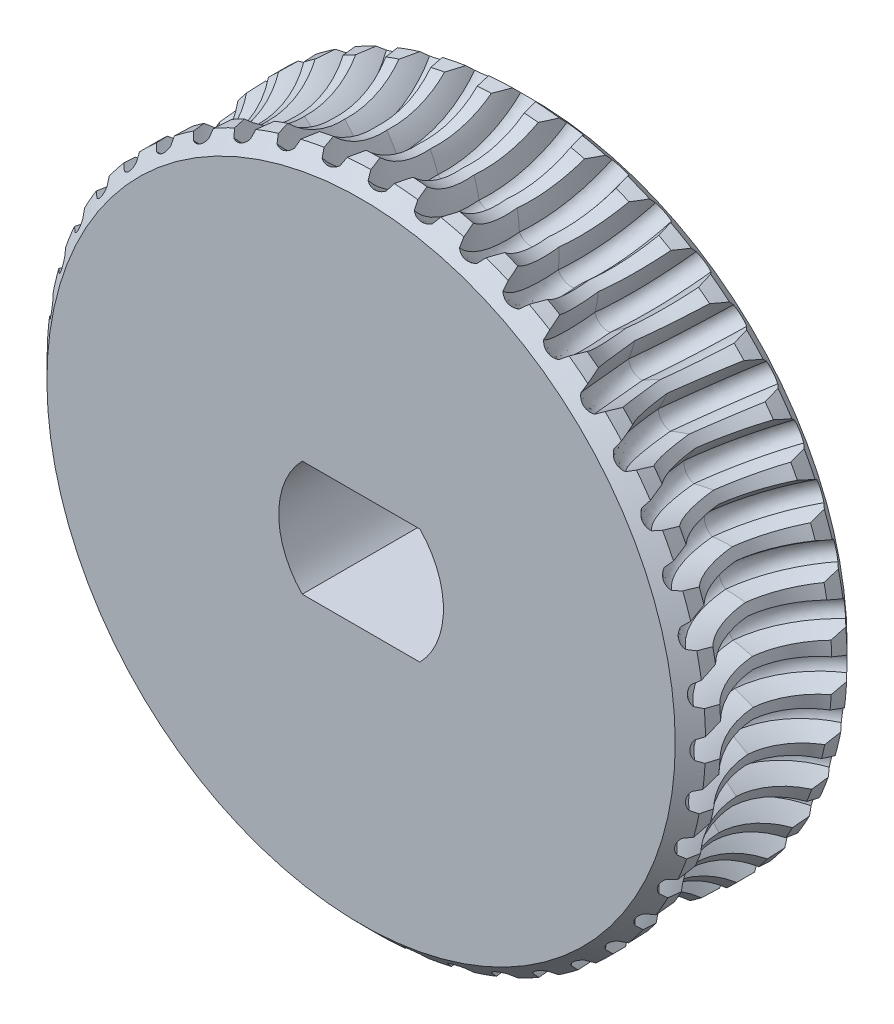
from build123d import *

# Parameters (mm, degrees)
SKETCH1_R                       = 43.5
BOSS_EXTRUDE1_DEPTH             = 11.35
CHAMFER1_SIZE                   = 2
SKETCH2_R                       = 10.5
CUT_SWEEP1_PITCH                = 6
CUT_SWEEP1_HEIGHT               = 1.5
CUT_SWEEP1_RADIUS               = 10.5
CUT_SWEEP1_START_ANGLE          = -90
CIRPATTERN1_COUNT               = 44
CIRPATTERN1_COPY_1_PITCH        = 6
CIRPATTERN1_COPY_1_HEIGHT       = 1.5
CIRPATTERN1_COPY_1_RADIUS       = 10.5
CIRPATTERN1_COPY_1_START_ANGLE  = -180
CIRPATTERN1_COPY_2_PITCH        = 6
CIRPATTERN1_COPY_2_HEIGHT       = 1.5
CIRPATTERN1_COPY_2_RADIUS       = 10.5
CIRPATTERN1_COPY_2_START_ANGLE  = -180
CIRPATTERN1_COPY_3_PITCH        = 6
CIRPATTERN1_COPY_3_HEIGHT       = 1.5
CIRPATTERN1_COPY_3_RADIUS       = 10.5
CIRPATTERN1_COPY_3_START_ANGLE  = -180
CIRPATTERN1_COPY_4_PITCH        = 6
CIRPATTERN1_COPY_4_HEIGHT       = 1.5
CIRPATTERN1_COPY_4_RADIUS       = 10.5
CIRPATTERN1_COPY_4_START_ANGLE  = -180
CIRPATTERN1_COPY_5_PITCH        = 6
CIRPATTERN1_COPY_5_HEIGHT       = 1.5
CIRPATTERN1_COPY_5_RADIUS       = 10.5
CIRPATTERN1_COPY_5_START_ANGLE  = -180
CIRPATTERN1_COPY_6_PITCH        = 6
CIRPATTERN1_COPY_6_HEIGHT       = 1.5
CIRPATTERN1_COPY_6_RADIUS       = 10.5
CIRPATTERN1_COPY_7_PITCH        = 6
CIRPATTERN1_COPY_7_HEIGHT       = 1.5
CIRPATTERN1_COPY_7_RADIUS       = 10.5
CIRPATTERN1_COPY_8_PITCH        = 6
CIRPATTERN1_COPY_8_HEIGHT       = 1.5
CIRPATTERN1_COPY_8_RADIUS       = 10.5
CIRPATTERN1_COPY_9_PITCH        = 6
CIRPATTERN1_COPY_9_HEIGHT       = 1.5
CIRPATTERN1_COPY_9_RADIUS       = 10.5
CIRPATTERN1_COPY_10_PITCH       = 6
CIRPATTERN1_COPY_10_HEIGHT      = 1.5
CIRPATTERN1_COPY_10_RADIUS      = 10.5
CIRPATTERN1_COPY_11_PITCH       = 6
CIRPATTERN1_COPY_11_HEIGHT      = 1.5
CIRPATTERN1_COPY_11_RADIUS      = 10.5
CIRPATTERN1_COPY_11_START_ANGLE = 90
CIRPATTERN1_COPY_12_PITCH       = 6
CIRPATTERN1_COPY_12_HEIGHT      = 1.5
CIRPATTERN1_COPY_12_RADIUS      = 10.5
CIRPATTERN1_COPY_13_PITCH       = 6
CIRPATTERN1_COPY_13_HEIGHT      = 1.5
CIRPATTERN1_COPY_13_RADIUS      = 10.5
CIRPATTERN1_COPY_14_PITCH       = 6
CIRPATTERN1_COPY_14_HEIGHT      = 1.5
CIRPATTERN1_COPY_14_RADIUS      = 10.5
CIRPATTERN1_COPY_15_PITCH       = 6
CIRPATTERN1_COPY_15_HEIGHT      = 1.5
CIRPATTERN1_COPY_15_RADIUS      = 10.5
CIRPATTERN1_COPY_16_PITCH       = 6
CIRPATTERN1_COPY_16_HEIGHT      = 1.5
CIRPATTERN1_COPY_16_RADIUS      = 10.5
CIRPATTERN1_COPY_17_PITCH       = 6
CIRPATTERN1_COPY_17_HEIGHT      = 1.5
CIRPATTERN1_COPY_17_RADIUS      = 10.5
CIRPATTERN1_COPY_17_START_ANGLE = -180
CIRPATTERN1_COPY_18_PITCH       = 6
CIRPATTERN1_COPY_18_HEIGHT      = 1.5
CIRPATTERN1_COPY_18_RADIUS      = 10.5
CIRPATTERN1_COPY_18_START_ANGLE = -180
CIRPATTERN1_COPY_19_PITCH       = 6
CIRPATTERN1_COPY_19_HEIGHT      = 1.5
CIRPATTERN1_COPY_19_RADIUS      = 10.5
CIRPATTERN1_COPY_19_START_ANGLE = -180
CIRPATTERN1_COPY_20_PITCH       = 6
CIRPATTERN1_COPY_20_HEIGHT      = 1.5
CIRPATTERN1_COPY_20_RADIUS      = 10.5
CIRPATTERN1_COPY_20_START_ANGLE = -180
CIRPATTERN1_COPY_21_PITCH       = 6
CIRPATTERN1_COPY_21_HEIGHT      = 1.5
CIRPATTERN1_COPY_21_RADIUS      = 10.5
CIRPATTERN1_COPY_21_START_ANGLE = -180
CIRPATTERN1_COPY_22_PITCH       = 6
CIRPATTERN1_COPY_22_HEIGHT      = 1.5
CIRPATTERN1_COPY_22_RADIUS      = 10.5
CIRPATTERN1_COPY_22_START_ANGLE = 90
CIRPATTERN1_COPY_23_PITCH       = 6
CIRPATTERN1_COPY_23_HEIGHT      = 1.5
CIRPATTERN1_COPY_23_RADIUS      = 10.5
CIRPATTERN1_COPY_23_START_ANGLE = -180
CIRPATTERN1_COPY_24_PITCH       = 6
CIRPATTERN1_COPY_24_HEIGHT      = 1.5
CIRPATTERN1_COPY_24_RADIUS      = 10.5
CIRPATTERN1_COPY_24_START_ANGLE = -180
CIRPATTERN1_COPY_25_PITCH       = 6
CIRPATTERN1_COPY_25_HEIGHT      = 1.5
CIRPATTERN1_COPY_25_RADIUS      = 10.5
CIRPATTERN1_COPY_25_START_ANGLE = -180
CIRPATTERN1_COPY_26_PITCH       = 6
CIRPATTERN1_COPY_26_HEIGHT      = 1.5
CIRPATTERN1_COPY_26_RADIUS      = 10.5
CIRPATTERN1_COPY_26_START_ANGLE = -180
CIRPATTERN1_COPY_27_PITCH       = 6
CIRPATTERN1_COPY_27_HEIGHT      = 1.5
CIRPATTERN1_COPY_27_RADIUS      = 10.5
CIRPATTERN1_COPY_27_START_ANGLE = -180
CIRPATTERN1_COPY_28_PITCH       = 6
CIRPATTERN1_COPY_28_HEIGHT      = 1.5
CIRPATTERN1_COPY_28_RADIUS      = 10.5
CIRPATTERN1_COPY_29_PITCH       = 6
CIRPATTERN1_COPY_29_HEIGHT      = 1.5
CIRPATTERN1_COPY_29_RADIUS      = 10.5
CIRPATTERN1_COPY_30_PITCH       = 6
CIRPATTERN1_COPY_30_HEIGHT      = 1.5
CIRPATTERN1_COPY_30_RADIUS      = 10.5
CIRPATTERN1_COPY_31_PITCH       = 6
CIRPATTERN1_COPY_31_HEIGHT      = 1.5
CIRPATTERN1_COPY_31_RADIUS      = 10.5
CIRPATTERN1_COPY_32_PITCH       = 6
CIRPATTERN1_COPY_32_HEIGHT      = 1.5
CIRPATTERN1_COPY_32_RADIUS      = 10.5
CIRPATTERN1_COPY_33_PITCH       = 6
CIRPATTERN1_COPY_33_HEIGHT      = 1.5
CIRPATTERN1_COPY_33_RADIUS      = 10.5
CIRPATTERN1_COPY_33_START_ANGLE = -90
CIRPATTERN1_COPY_34_PITCH       = 6
CIRPATTERN1_COPY_34_HEIGHT      = 1.5
CIRPATTERN1_COPY_34_RADIUS      = 10.5
CIRPATTERN1_COPY_35_PITCH       = 6
CIRPATTERN1_COPY_35_HEIGHT      = 1.5
CIRPATTERN1_COPY_35_RADIUS      = 10.5
CIRPATTERN1_COPY_36_PITCH       = 6
CIRPATTERN1_COPY_36_HEIGHT      = 1.5
CIRPATTERN1_COPY_36_RADIUS      = 10.5
CIRPATTERN1_COPY_37_PITCH       = 6
CIRPATTERN1_COPY_37_HEIGHT      = 1.5
CIRPATTERN1_COPY_37_RADIUS      = 10.5
CIRPATTERN1_COPY_38_PITCH       = 6
CIRPATTERN1_COPY_38_HEIGHT      = 1.5
CIRPATTERN1_COPY_38_RADIUS      = 10.5
CIRPATTERN1_COPY_39_PITCH       = 6
CIRPATTERN1_COPY_39_HEIGHT      = 1.5
CIRPATTERN1_COPY_39_RADIUS      = 10.5
CIRPATTERN1_COPY_39_START_ANGLE = -180
CIRPATTERN1_COPY_40_PITCH       = 6
CIRPATTERN1_COPY_40_HEIGHT      = 1.5
CIRPATTERN1_COPY_40_RADIUS      = 10.5
CIRPATTERN1_COPY_40_START_ANGLE = -180
CIRPATTERN1_COPY_41_PITCH       = 6
CIRPATTERN1_COPY_41_HEIGHT      = 1.5
CIRPATTERN1_COPY_41_RADIUS      = 10.5
CIRPATTERN1_COPY_41_START_ANGLE = -180
CIRPATTERN1_COPY_42_PITCH       = 6
CIRPATTERN1_COPY_42_HEIGHT      = 1.5
CIRPATTERN1_COPY_42_RADIUS      = 10.5
CIRPATTERN1_COPY_42_START_ANGLE = -180
CIRPATTERN1_COPY_43_PITCH       = 6
CIRPATTERN1_COPY_43_HEIGHT      = 1.5
CIRPATTERN1_COPY_43_RADIUS      = 10.5
CIRPATTERN1_COPY_43_START_ANGLE = -180
ESCALA2_SCALE                   = 0.2298
CORTE_EXTRUS_O1_DEPTH           = 35


with BuildPart() as part:
    # Sketch1 → Boss-Extrude1 (new, symmetric)
    with BuildSketch(Plane.XY):
        Circle(SKETCH1_R)
    extrude(amount=BOSS_EXTRUDE1_DEPTH, both=True)

    # Chamfer1
    chamfer1_edges = [part.edges().sort_by_distance(p)[0] for p in [
        (-43.5, 0, -11.35),
        (-43.5, 0, 11.35),
    ]]
    chamfer(chamfer1_edges, length=CHAMFER1_SIZE)

    # Sketch2 → Cut-Revolve2 (revolve, cut)
    with BuildSketch(Plane(origin=(0, 0, 0), x_dir=(0, 0, -1), z_dir=(1, 0, 0)), mode=Mode.PRIVATE) as cut_revolve2_sk:
        with Locations((0, -51)):
            Circle(SKETCH2_R)
    cut_revolve2 = revolve(cut_revolve2_sk.sketch.rotate(Axis((0, 0, 0), (0, 0, -1)), 270), axis=Axis((0, 0, 0), (0, 0, -1)), mode=Mode.SUBTRACT)

    # Cut-Sweep1: sweep along a helix
    with BuildLine() as cut_sweep1_path:
        add(Helix(CUT_SWEEP1_PITCH, CUT_SWEEP1_HEIGHT, CUT_SWEEP1_RADIUS, center=(0, -51, 0), direction=(-1, 0, 0), lefthand=True, mode=Mode.PRIVATE).rotate(Axis((0, -51, 0), (-1, 0, 0)), CUT_SWEEP1_START_ANGLE))
    # Sketch4 → Cut-Sweep1 (sweep, cut)
    with BuildSketch(Plane.XY):
        with BuildLine():
            Line((-3.36, -44.65), (3.54, -44.65))
            Line((3.54, -44.65), (3.54, -42.65))
            ThreePointArc((3.54, -42.65), (2.196170057, -40.410449873), (1.19058809, -38))
            ThreePointArc((1.19058809, -38), (0, -37.55), (-1.19058809, -38))
            ThreePointArc((-1.19058809, -38), (-2.108749999, -40.402699492), (-3.36, -42.65))
            Line((-3.36, -42.65), (-3.36, -44.65))
        make_face()
    cut_sweep1 = sweep(path=cut_sweep1_path.line, is_frenet=True, mode=Mode.SUBTRACT)

    # Mirror1: Cut-Sweep1 across plane
    add(cut_sweep1.mirror(Plane.XY), mode=Mode.SUBTRACT)

    # CirPattern1: Cut-Revolve2, Cut-Sweep1 ×44 about axis
    cirpattern1_axis = Axis((0, 0, 7.348469228), (0, 0, -1))
    add([cut_revolve2.rotate(cirpattern1_axis, i * 360 / CIRPATTERN1_COUNT) for i in range(1, CIRPATTERN1_COUNT)], mode=Mode.SUBTRACT)
    add([cut_sweep1.rotate(cirpattern1_axis, i * 360 / CIRPATTERN1_COUNT) for i in range(1, CIRPATTERN1_COUNT)], mode=Mode.SUBTRACT)

    # CirPattern1 copy 1: sweep along a helix
    with BuildLine() as cirpattern1_copy_1_path:
        add(Helix(CIRPATTERN1_COPY_1_PITCH, CIRPATTERN1_COPY_1_HEIGHT, CIRPATTERN1_COPY_1_RADIUS, center=(-7.258056752, -50.480893536, 0), direction=(-0.9898214418809327, 0.14231483827328514, 0), mode=Mode.PRIVATE).rotate(Axis((-7.258056752, -50.480893536, 0), (-0.9898214418809327, 0.14231483827328514, 0)), CIRPATTERN1_COPY_1_START_ANGLE))
    # CirPattern1 copy 1 sketch → CirPattern1 copy 1 (sweep, cut)
    with BuildSketch(Plane(origin=(0, 0, 0), x_dir=(0.9898214418809327, -0.14231483827328514, 0), z_dir=(0, 0, -1))):
        with BuildLine():
            Line((-3.36, 44.65), (3.54, 44.65))
            Line((3.54, 44.65), (3.54, 42.65))
            ThreePointArc((3.54, 42.65), (2.196170057, 40.410449873), (1.19058809, 38))
            ThreePointArc((1.19058809, 38), (0, 37.55), (-1.19058809, 38))
            ThreePointArc((-1.19058809, 38), (-2.108749999, 40.402699492), (-3.36, 42.65))
            Line((-3.36, 42.65), (-3.36, 44.65))
        make_face()
    sweep(path=cirpattern1_copy_1_path.line, is_frenet=True, mode=Mode.SUBTRACT)

    # CirPattern1 copy 2: sweep along a helix
    with BuildLine() as cirpattern1_copy_2_path:
        add(Helix(CIRPATTERN1_COPY_2_PITCH, CIRPATTERN1_COPY_2_HEIGHT, CIRPATTERN1_COPY_2_RADIUS, center=(-14.368360399, -48.934141654, 0), direction=(-0.9594929736144974, 0.28173255684142967, 0), mode=Mode.PRIVATE).rotate(Axis((-14.368360399, -48.934141654, 0), (-0.9594929736144974, 0.28173255684142967, 0)), CIRPATTERN1_COPY_2_START_ANGLE))
    # CirPattern1 copy 2 sketch → CirPattern1 copy 2 (sweep, cut)
    with BuildSketch(Plane(origin=(0, 0, 0), x_dir=(0.9594929736144974, -0.28173255684142967, 0), z_dir=(0, 0, -1))):
        with BuildLine():
            Line((-3.36, 44.65), (3.54, 44.65))
            Line((3.54, 44.65), (3.54, 42.65))
            ThreePointArc((3.54, 42.65), (2.196170057, 40.410449873), (1.19058809, 38))
            ThreePointArc((1.19058809, 38), (0, 37.55), (-1.19058809, 38))
            ThreePointArc((-1.19058809, 38), (-2.108749999, 40.402699492), (-3.36, 42.65))
            Line((-3.36, 42.65), (-3.36, 44.65))
        make_face()
    sweep(path=cirpattern1_copy_2_path.line, is_frenet=True, mode=Mode.SUBTRACT)

    # CirPattern1 copy 3: sweep along a helix
    with BuildLine() as cirpattern1_copy_3_path:
        add(Helix(CIRPATTERN1_COPY_3_PITCH, CIRPATTERN1_COPY_3_HEIGHT, CIRPATTERN1_COPY_3_RADIUS, center=(-21.186165663, -46.391231763, 0), direction=(-0.9096319953545183, 0.41541501300188644, 0), mode=Mode.PRIVATE).rotate(Axis((-21.186165663, -46.391231763, 0), (-0.9096319953545183, 0.41541501300188644, 0)), CIRPATTERN1_COPY_3_START_ANGLE))
    # CirPattern1 copy 3 sketch → CirPattern1 copy 3 (sweep, cut)
    with BuildSketch(Plane(origin=(0, 0, 0), x_dir=(0.9096319953545183, -0.41541501300188644, 0), z_dir=(0, 0, -1))):
        with BuildLine():
            Line((-3.36, 44.65), (3.54, 44.65))
            Line((3.54, 44.65), (3.54, 42.65))
            ThreePointArc((3.54, 42.65), (2.196170057, 40.410449873), (1.19058809, 38))
            ThreePointArc((1.19058809, 38), (0, 37.55), (-1.19058809, 38))
            ThreePointArc((-1.19058809, 38), (-2.108749999, 40.402699492), (-3.36, 42.65))
            Line((-3.36, 42.65), (-3.36, 44.65))
        make_face()
    sweep(path=cirpattern1_copy_3_path.line, is_frenet=True, mode=Mode.SUBTRACT)

    # CirPattern1 copy 4: sweep along a helix
    with BuildLine() as cirpattern1_copy_4_path:
        add(Helix(CIRPATTERN1_COPY_4_PITCH, CIRPATTERN1_COPY_4_HEIGHT, CIRPATTERN1_COPY_4_RADIUS, center=(-27.57268169, -42.903930174, 0), direction=(-0.8412535328311812, 0.5406408174555976, 0), mode=Mode.PRIVATE).rotate(Axis((-27.57268169, -42.903930174, 0), (-0.8412535328311812, 0.5406408174555976, 0)), CIRPATTERN1_COPY_4_START_ANGLE))
    # CirPattern1 copy 4 sketch → CirPattern1 copy 4 (sweep, cut)
    with BuildSketch(Plane(origin=(0, 0, 0), x_dir=(0.8412535328311812, -0.5406408174555976, 0), z_dir=(0, 0, -1))):
        with BuildLine():
            Line((-3.36, 44.65), (3.54, 44.65))
            Line((3.54, 44.65), (3.54, 42.65))
            ThreePointArc((3.54, 42.65), (2.196170057, 40.410449873), (1.19058809, 38))
            ThreePointArc((1.19058809, 38), (0, 37.55), (-1.19058809, 38))
            ThreePointArc((-1.19058809, 38), (-2.108749999, 40.402699492), (-3.36, 42.65))
            Line((-3.36, 42.65), (-3.36, 44.65))
        make_face()
    sweep(path=cirpattern1_copy_4_path.line, is_frenet=True, mode=Mode.SUBTRACT)

    # CirPattern1 copy 5: sweep along a helix
    with BuildLine() as cirpattern1_copy_5_path:
        add(Helix(CIRPATTERN1_COPY_5_PITCH, CIRPATTERN1_COPY_5_HEIGHT, CIRPATTERN1_COPY_5_RADIUS, center=(-33.397897431, -38.543228292, 0), direction=(-0.7557495743542584, 0.654860733945285, 0), mode=Mode.PRIVATE).rotate(Axis((-33.397897431, -38.543228292, 0), (-0.7557495743542584, 0.654860733945285, 0)), CIRPATTERN1_COPY_5_START_ANGLE))
    # CirPattern1 copy 5 sketch → CirPattern1 copy 5 (sweep, cut)
    with BuildSketch(Plane(origin=(0, 0, 0), x_dir=(0.7557495743542584, -0.654860733945285, 0), z_dir=(0, 0, -1))):
        with BuildLine():
            Line((-3.36, 44.65), (3.54, 44.65))
            Line((3.54, 44.65), (3.54, 42.65))
            ThreePointArc((3.54, 42.65), (2.196170057, 40.410449873), (1.19058809, 38))
            ThreePointArc((1.19058809, 38), (0, 37.55), (-1.19058809, 38))
            ThreePointArc((-1.19058809, 38), (-2.108749999, 40.402699492), (-3.36, 42.65))
            Line((-3.36, 42.65), (-3.36, 44.65))
        make_face()
    sweep(path=cirpattern1_copy_5_path.line, is_frenet=True, mode=Mode.SUBTRACT)

    # CirPattern1 copy 6: sweep along a helix
    with BuildLine() as cirpattern1_copy_6_path:
        Helix(CIRPATTERN1_COPY_6_PITCH, CIRPATTERN1_COPY_6_HEIGHT, CIRPATTERN1_COPY_6_RADIUS, center=(-38.543228292, -33.397897431, 0), direction=(-0.654860733945285, 0.7557495743542583, 0))
    # CirPattern1 copy 6 sketch → CirPattern1 copy 6 (sweep, cut)
    with BuildSketch(Plane(origin=(0, 0, 0), x_dir=(0.654860733945285, -0.7557495743542583, 0), z_dir=(0, 0, -1))):
        with BuildLine():
            Line((-3.36, 44.65), (3.54, 44.65))
            Line((3.54, 44.65), (3.54, 42.65))
            ThreePointArc((3.54, 42.65), (2.196170057, 40.410449873), (1.19058809, 38))
            ThreePointArc((1.19058809, 38), (0, 37.55), (-1.19058809, 38))
            ThreePointArc((-1.19058809, 38), (-2.108749999, 40.402699492), (-3.36, 42.65))
            Line((-3.36, 42.65), (-3.36, 44.65))
        make_face()
    sweep(path=cirpattern1_copy_6_path.line, is_frenet=True, mode=Mode.SUBTRACT)

    # CirPattern1 copy 7: sweep along a helix
    with BuildLine() as cirpattern1_copy_7_path:
        Helix(CIRPATTERN1_COPY_7_PITCH, CIRPATTERN1_COPY_7_HEIGHT, CIRPATTERN1_COPY_7_RADIUS, center=(-42.903930174, -27.57268169, 0), direction=(-0.5406408174555977, 0.8412535328311811, 0))
    # CirPattern1 copy 7 sketch → CirPattern1 copy 7 (sweep, cut)
    with BuildSketch(Plane(origin=(0, 0, 0), x_dir=(0.5406408174555977, -0.8412535328311811, 0), z_dir=(0, 0, -1))):
        with BuildLine():
            Line((-3.36, 44.65), (3.54, 44.65))
            Line((3.54, 44.65), (3.54, 42.65))
            ThreePointArc((3.54, 42.65), (2.196170057, 40.410449873), (1.19058809, 38))
            ThreePointArc((1.19058809, 38), (0, 37.55), (-1.19058809, 38))
            ThreePointArc((-1.19058809, 38), (-2.108749999, 40.402699492), (-3.36, 42.65))
            Line((-3.36, 42.65), (-3.36, 44.65))
        make_face()
    sweep(path=cirpattern1_copy_7_path.line, is_frenet=True, mode=Mode.SUBTRACT)

    # CirPattern1 copy 8: sweep along a helix
    with BuildLine() as cirpattern1_copy_8_path:
        Helix(CIRPATTERN1_COPY_8_PITCH, CIRPATTERN1_COPY_8_HEIGHT, CIRPATTERN1_COPY_8_RADIUS, center=(-46.391231763, -21.186165663, 0), direction=(-0.41541501300188644, 0.9096319953545183, 0))
    # CirPattern1 copy 8 sketch → CirPattern1 copy 8 (sweep, cut)
    with BuildSketch(Plane(origin=(0, 0, 0), x_dir=(0.41541501300188644, -0.9096319953545183, 0), z_dir=(0, 0, -1))):
        with BuildLine():
            Line((-3.36, 44.65), (3.54, 44.65))
            Line((3.54, 44.65), (3.54, 42.65))
            ThreePointArc((3.54, 42.65), (2.196170057, 40.410449873), (1.19058809, 38))
            ThreePointArc((1.19058809, 38), (0, 37.55), (-1.19058809, 38))
            ThreePointArc((-1.19058809, 38), (-2.108749999, 40.402699492), (-3.36, 42.65))
            Line((-3.36, 42.65), (-3.36, 44.65))
        make_face()
    sweep(path=cirpattern1_copy_8_path.line, is_frenet=True, mode=Mode.SUBTRACT)

    # CirPattern1 copy 9: sweep along a helix
    with BuildLine() as cirpattern1_copy_9_path:
        Helix(CIRPATTERN1_COPY_9_PITCH, CIRPATTERN1_COPY_9_HEIGHT, CIRPATTERN1_COPY_9_RADIUS, center=(-48.934141654, -14.368360399, 0), direction=(-0.2817325568414296, 0.9594929736144974, 0))
    # CirPattern1 copy 9 sketch → CirPattern1 copy 9 (sweep, cut)
    with BuildSketch(Plane(origin=(0, 0, 0), x_dir=(0.2817325568414296, -0.9594929736144974, 0), z_dir=(0, 0, -1))):
        with BuildLine():
            Line((-3.36, 44.65), (3.54, 44.65))
            Line((3.54, 44.65), (3.54, 42.65))
            ThreePointArc((3.54, 42.65), (2.196170057, 40.410449873), (1.19058809, 38))
            ThreePointArc((1.19058809, 38), (0, 37.55), (-1.19058809, 38))
            ThreePointArc((-1.19058809, 38), (-2.108749999, 40.402699492), (-3.36, 42.65))
            Line((-3.36, 42.65), (-3.36, 44.65))
        make_face()
    sweep(path=cirpattern1_copy_9_path.line, is_frenet=True, mode=Mode.SUBTRACT)

    # CirPattern1 copy 10: sweep along a helix
    with BuildLine() as cirpattern1_copy_10_path:
        Helix(CIRPATTERN1_COPY_10_PITCH, CIRPATTERN1_COPY_10_HEIGHT, CIRPATTERN1_COPY_10_RADIUS, center=(-50.480893536, -7.258056752, 0), direction=(-0.14231483827328534, 0.9898214418809327, 0))
    # CirPattern1 copy 10 sketch → CirPattern1 copy 10 (sweep, cut)
    with BuildSketch(Plane(origin=(0, 0, 0), x_dir=(0.14231483827328534, -0.9898214418809327, 0), z_dir=(0, 0, -1))):
        with BuildLine():
            Line((-3.36, 44.65), (3.54, 44.65))
            Line((3.54, 44.65), (3.54, 42.65))
            ThreePointArc((3.54, 42.65), (2.196170057, 40.410449873), (1.19058809, 38))
            ThreePointArc((1.19058809, 38), (0, 37.55), (-1.19058809, 38))
            ThreePointArc((-1.19058809, 38), (-2.108749999, 40.402699492), (-3.36, 42.65))
            Line((-3.36, 42.65), (-3.36, 44.65))
        make_face()
    sweep(path=cirpattern1_copy_10_path.line, is_frenet=True, mode=Mode.SUBTRACT)

    # CirPattern1 copy 11: sweep along a helix
    with BuildLine() as cirpattern1_copy_11_path:
        add(Helix(CIRPATTERN1_COPY_11_PITCH, CIRPATTERN1_COPY_11_HEIGHT, CIRPATTERN1_COPY_11_RADIUS, center=(-51, 0, 0), direction=(0, 1, 0), mode=Mode.PRIVATE).rotate(Axis((-51, 0, 0), (0, 1, 0)), CIRPATTERN1_COPY_11_START_ANGLE))
    # CirPattern1 copy 11 sketch → CirPattern1 copy 11 (sweep, cut)
    with BuildSketch(Plane(origin=(0, 0, 0), x_dir=(0, -1, 0), z_dir=(0, 0, -1))):
        with BuildLine():
            Line((-3.36, 44.65), (3.54, 44.65))
            Line((3.54, 44.65), (3.54, 42.65))
            ThreePointArc((3.54, 42.65), (2.196170057, 40.410449873), (1.19058809, 38))
            ThreePointArc((1.19058809, 38), (0, 37.55), (-1.19058809, 38))
            ThreePointArc((-1.19058809, 38), (-2.108749999, 40.402699492), (-3.36, 42.65))
            Line((-3.36, 42.65), (-3.36, 44.65))
        make_face()
    sweep(path=cirpattern1_copy_11_path.line, is_frenet=True, mode=Mode.SUBTRACT)

    # CirPattern1 copy 12: sweep along a helix
    with BuildLine() as cirpattern1_copy_12_path:
        Helix(CIRPATTERN1_COPY_12_PITCH, CIRPATTERN1_COPY_12_HEIGHT, CIRPATTERN1_COPY_12_RADIUS, center=(-50.480893536, 7.258056752, 0), direction=(0.14231483827328523, 0.9898214418809327, 0))
    # CirPattern1 copy 12 sketch → CirPattern1 copy 12 (sweep, cut)
    with BuildSketch(Plane(origin=(0, 0, 0), x_dir=(-0.14231483827328523, -0.9898214418809327, 0), z_dir=(0, 0, -1))):
        with BuildLine():
            Line((-3.36, 44.65), (3.54, 44.65))
            Line((3.54, 44.65), (3.54, 42.65))
            ThreePointArc((3.54, 42.65), (2.196170057, 40.410449873), (1.19058809, 38))
            ThreePointArc((1.19058809, 38), (0, 37.55), (-1.19058809, 38))
            ThreePointArc((-1.19058809, 38), (-2.108749999, 40.402699492), (-3.36, 42.65))
            Line((-3.36, 42.65), (-3.36, 44.65))
        make_face()
    sweep(path=cirpattern1_copy_12_path.line, is_frenet=True, mode=Mode.SUBTRACT)

    # CirPattern1 copy 13: sweep along a helix
    with BuildLine() as cirpattern1_copy_13_path:
        Helix(CIRPATTERN1_COPY_13_PITCH, CIRPATTERN1_COPY_13_HEIGHT, CIRPATTERN1_COPY_13_RADIUS, center=(-48.934141654, 14.368360399, 0), direction=(0.28173255684142967, 0.9594929736144974, 0))
    # CirPattern1 copy 13 sketch → CirPattern1 copy 13 (sweep, cut)
    with BuildSketch(Plane(origin=(0, 0, 0), x_dir=(-0.28173255684142967, -0.9594929736144974, 0), z_dir=(0, 0, -1))):
        with BuildLine():
            Line((-3.36, 44.65), (3.54, 44.65))
            Line((3.54, 44.65), (3.54, 42.65))
            ThreePointArc((3.54, 42.65), (2.196170057, 40.410449873), (1.19058809, 38))
            ThreePointArc((1.19058809, 38), (0, 37.55), (-1.19058809, 38))
            ThreePointArc((-1.19058809, 38), (-2.108749999, 40.402699492), (-3.36, 42.65))
            Line((-3.36, 42.65), (-3.36, 44.65))
        make_face()
    sweep(path=cirpattern1_copy_13_path.line, is_frenet=True, mode=Mode.SUBTRACT)

    # CirPattern1 copy 14: sweep along a helix
    with BuildLine() as cirpattern1_copy_14_path:
        Helix(CIRPATTERN1_COPY_14_PITCH, CIRPATTERN1_COPY_14_HEIGHT, CIRPATTERN1_COPY_14_RADIUS, center=(-46.391231763, 21.186165663, 0), direction=(0.4154150130018863, 0.9096319953545184, 0))
    # CirPattern1 copy 14 sketch → CirPattern1 copy 14 (sweep, cut)
    with BuildSketch(Plane(origin=(0, 0, 0), x_dir=(-0.4154150130018863, -0.9096319953545184, 0), z_dir=(0, 0, -1))):
        with BuildLine():
            Line((-3.36, 44.65), (3.54, 44.65))
            Line((3.54, 44.65), (3.54, 42.65))
            ThreePointArc((3.54, 42.65), (2.196170057, 40.410449873), (1.19058809, 38))
            ThreePointArc((1.19058809, 38), (0, 37.55), (-1.19058809, 38))
            ThreePointArc((-1.19058809, 38), (-2.108749999, 40.402699492), (-3.36, 42.65))
            Line((-3.36, 42.65), (-3.36, 44.65))
        make_face()
    sweep(path=cirpattern1_copy_14_path.line, is_frenet=True, mode=Mode.SUBTRACT)

    # CirPattern1 copy 15: sweep along a helix
    with BuildLine() as cirpattern1_copy_15_path:
        Helix(CIRPATTERN1_COPY_15_PITCH, CIRPATTERN1_COPY_15_HEIGHT, CIRPATTERN1_COPY_15_RADIUS, center=(-42.903930174, 27.57268169, 0), direction=(0.5406408174555977, 0.8412535328311811, 0))
    # CirPattern1 copy 15 sketch → CirPattern1 copy 15 (sweep, cut)
    with BuildSketch(Plane(origin=(0, 0, 0), x_dir=(-0.5406408174555977, -0.8412535328311811, 0), z_dir=(0, 0, -1))):
        with BuildLine():
            Line((-3.36, 44.65), (3.54, 44.65))
            Line((3.54, 44.65), (3.54, 42.65))
            ThreePointArc((3.54, 42.65), (2.196170057, 40.410449873), (1.19058809, 38))
            ThreePointArc((1.19058809, 38), (0, 37.55), (-1.19058809, 38))
            ThreePointArc((-1.19058809, 38), (-2.108749999, 40.402699492), (-3.36, 42.65))
            Line((-3.36, 42.65), (-3.36, 44.65))
        make_face()
    sweep(path=cirpattern1_copy_15_path.line, is_frenet=True, mode=Mode.SUBTRACT)

    # CirPattern1 copy 16: sweep along a helix
    with BuildLine() as cirpattern1_copy_16_path:
        Helix(CIRPATTERN1_COPY_16_PITCH, CIRPATTERN1_COPY_16_HEIGHT, CIRPATTERN1_COPY_16_RADIUS, center=(-38.543228292, 33.397897431, 0), direction=(0.654860733945285, 0.7557495743542583, 0))
    # CirPattern1 copy 16 sketch → CirPattern1 copy 16 (sweep, cut)
    with BuildSketch(Plane(origin=(0, 0, 0), x_dir=(-0.654860733945285, -0.7557495743542583, 0), z_dir=(0, 0, -1))):
        with BuildLine():
            Line((-3.36, 44.65), (3.54, 44.65))
            Line((3.54, 44.65), (3.54, 42.65))
            ThreePointArc((3.54, 42.65), (2.196170057, 40.410449873), (1.19058809, 38))
            ThreePointArc((1.19058809, 38), (0, 37.55), (-1.19058809, 38))
            ThreePointArc((-1.19058809, 38), (-2.108749999, 40.402699492), (-3.36, 42.65))
            Line((-3.36, 42.65), (-3.36, 44.65))
        make_face()
    sweep(path=cirpattern1_copy_16_path.line, is_frenet=True, mode=Mode.SUBTRACT)

    # CirPattern1 copy 17: sweep along a helix
    with BuildLine() as cirpattern1_copy_17_path:
        add(Helix(CIRPATTERN1_COPY_17_PITCH, CIRPATTERN1_COPY_17_HEIGHT, CIRPATTERN1_COPY_17_RADIUS, center=(-33.397897431, 38.543228292, 0), direction=(0.7557495743542582, 0.6548607339452852, 0), mode=Mode.PRIVATE).rotate(Axis((-33.397897431, 38.543228292, 0), (0.7557495743542582, 0.6548607339452852, 0)), CIRPATTERN1_COPY_17_START_ANGLE))
    # CirPattern1 copy 17 sketch → CirPattern1 copy 17 (sweep, cut)
    with BuildSketch(Plane(origin=(0, 0, 0), x_dir=(-0.7557495743542582, -0.6548607339452852, 0), z_dir=(0, 0, -1))):
        with BuildLine():
            Line((-3.36, 44.65), (3.54, 44.65))
            Line((3.54, 44.65), (3.54, 42.65))
            ThreePointArc((3.54, 42.65), (2.196170057, 40.410449873), (1.19058809, 38))
            ThreePointArc((1.19058809, 38), (0, 37.55), (-1.19058809, 38))
            ThreePointArc((-1.19058809, 38), (-2.108749999, 40.402699492), (-3.36, 42.65))
            Line((-3.36, 42.65), (-3.36, 44.65))
        make_face()
    sweep(path=cirpattern1_copy_17_path.line, is_frenet=True, mode=Mode.SUBTRACT)

    # CirPattern1 copy 18: sweep along a helix
    with BuildLine() as cirpattern1_copy_18_path:
        add(Helix(CIRPATTERN1_COPY_18_PITCH, CIRPATTERN1_COPY_18_HEIGHT, CIRPATTERN1_COPY_18_RADIUS, center=(-27.57268169, 42.903930174, 0), direction=(0.8412535328311813, 0.5406408174555974, 0), mode=Mode.PRIVATE).rotate(Axis((-27.57268169, 42.903930174, 0), (0.8412535328311813, 0.5406408174555974, 0)), CIRPATTERN1_COPY_18_START_ANGLE))
    # CirPattern1 copy 18 sketch → CirPattern1 copy 18 (sweep, cut)
    with BuildSketch(Plane(origin=(0, 0, 0), x_dir=(-0.8412535328311813, -0.5406408174555974, 0), z_dir=(0, 0, -1))):
        with BuildLine():
            Line((-3.36, 44.65), (3.54, 44.65))
            Line((3.54, 44.65), (3.54, 42.65))
            ThreePointArc((3.54, 42.65), (2.196170057, 40.410449873), (1.19058809, 38))
            ThreePointArc((1.19058809, 38), (0, 37.55), (-1.19058809, 38))
            ThreePointArc((-1.19058809, 38), (-2.108749999, 40.402699492), (-3.36, 42.65))
            Line((-3.36, 42.65), (-3.36, 44.65))
        make_face()
    sweep(path=cirpattern1_copy_18_path.line, is_frenet=True, mode=Mode.SUBTRACT)

    # CirPattern1 copy 19: sweep along a helix
    with BuildLine() as cirpattern1_copy_19_path:
        add(Helix(CIRPATTERN1_COPY_19_PITCH, CIRPATTERN1_COPY_19_HEIGHT, CIRPATTERN1_COPY_19_RADIUS, center=(-21.186165663, 46.391231763, 0), direction=(0.9096319953545182, 0.4154150130018867, 0), mode=Mode.PRIVATE).rotate(Axis((-21.186165663, 46.391231763, 0), (0.9096319953545182, 0.4154150130018867, 0)), CIRPATTERN1_COPY_19_START_ANGLE))
    # CirPattern1 copy 19 sketch → CirPattern1 copy 19 (sweep, cut)
    with BuildSketch(Plane(origin=(0, 0, 0), x_dir=(-0.9096319953545182, -0.4154150130018867, 0), z_dir=(0, 0, -1))):
        with BuildLine():
            Line((-3.36, 44.65), (3.54, 44.65))
            Line((3.54, 44.65), (3.54, 42.65))
            ThreePointArc((3.54, 42.65), (2.196170057, 40.410449873), (1.19058809, 38))
            ThreePointArc((1.19058809, 38), (0, 37.55), (-1.19058809, 38))
            ThreePointArc((-1.19058809, 38), (-2.108749999, 40.402699492), (-3.36, 42.65))
            Line((-3.36, 42.65), (-3.36, 44.65))
        make_face()
    sweep(path=cirpattern1_copy_19_path.line, is_frenet=True, mode=Mode.SUBTRACT)

    # CirPattern1 copy 20: sweep along a helix
    with BuildLine() as cirpattern1_copy_20_path:
        add(Helix(CIRPATTERN1_COPY_20_PITCH, CIRPATTERN1_COPY_20_HEIGHT, CIRPATTERN1_COPY_20_RADIUS, center=(-14.368360399, 48.934141654, 0), direction=(0.9594929736144973, 0.28173255684143006, 0), mode=Mode.PRIVATE).rotate(Axis((-14.368360399, 48.934141654, 0), (0.9594929736144973, 0.28173255684143006, 0)), CIRPATTERN1_COPY_20_START_ANGLE))
    # CirPattern1 copy 20 sketch → CirPattern1 copy 20 (sweep, cut)
    with BuildSketch(Plane(origin=(0, 0, 0), x_dir=(-0.9594929736144973, -0.28173255684143006, 0), z_dir=(0, 0, -1))):
        with BuildLine():
            Line((-3.36, 44.65), (3.54, 44.65))
            Line((3.54, 44.65), (3.54, 42.65))
            ThreePointArc((3.54, 42.65), (2.196170057, 40.410449873), (1.19058809, 38))
            ThreePointArc((1.19058809, 38), (0, 37.55), (-1.19058809, 38))
            ThreePointArc((-1.19058809, 38), (-2.108749999, 40.402699492), (-3.36, 42.65))
            Line((-3.36, 42.65), (-3.36, 44.65))
        make_face()
    sweep(path=cirpattern1_copy_20_path.line, is_frenet=True, mode=Mode.SUBTRACT)

    # CirPattern1 copy 21: sweep along a helix
    with BuildLine() as cirpattern1_copy_21_path:
        add(Helix(CIRPATTERN1_COPY_21_PITCH, CIRPATTERN1_COPY_21_HEIGHT, CIRPATTERN1_COPY_21_RADIUS, center=(-7.258056752, 50.480893536, 0), direction=(0.9898214418809327, 0.14231483827328517, 0), mode=Mode.PRIVATE).rotate(Axis((-7.258056752, 50.480893536, 0), (0.9898214418809327, 0.14231483827328517, 0)), CIRPATTERN1_COPY_21_START_ANGLE))
    # CirPattern1 copy 21 sketch → CirPattern1 copy 21 (sweep, cut)
    with BuildSketch(Plane(origin=(0, 0, 0), x_dir=(-0.9898214418809327, -0.14231483827328517, 0), z_dir=(0, 0, -1))):
        with BuildLine():
            Line((-3.36, 44.65), (3.54, 44.65))
            Line((3.54, 44.65), (3.54, 42.65))
            ThreePointArc((3.54, 42.65), (2.196170057, 40.410449873), (1.19058809, 38))
            ThreePointArc((1.19058809, 38), (0, 37.55), (-1.19058809, 38))
            ThreePointArc((-1.19058809, 38), (-2.108749999, 40.402699492), (-3.36, 42.65))
            Line((-3.36, 42.65), (-3.36, 44.65))
        make_face()
    sweep(path=cirpattern1_copy_21_path.line, is_frenet=True, mode=Mode.SUBTRACT)

    # CirPattern1 copy 22: sweep along a helix
    with BuildLine() as cirpattern1_copy_22_path:
        add(Helix(CIRPATTERN1_COPY_22_PITCH, CIRPATTERN1_COPY_22_HEIGHT, CIRPATTERN1_COPY_22_RADIUS, center=(0, 51, 0), direction=(1, 0, 0), mode=Mode.PRIVATE).rotate(Axis((0, 51, 0), (1, 0, 0)), CIRPATTERN1_COPY_22_START_ANGLE))
    # CirPattern1 copy 22 sketch → CirPattern1 copy 22 (sweep, cut)
    with BuildSketch(Plane(origin=(0, 0, 0), x_dir=(-1, 0, 0), z_dir=(0, 0, -1))):
        with BuildLine():
            Line((-3.36, 44.65), (3.54, 44.65))
            Line((3.54, 44.65), (3.54, 42.65))
            ThreePointArc((3.54, 42.65), (2.196170057, 40.410449873), (1.19058809, 38))
            ThreePointArc((1.19058809, 38), (0, 37.55), (-1.19058809, 38))
            ThreePointArc((-1.19058809, 38), (-2.108749999, 40.402699492), (-3.36, 42.65))
            Line((-3.36, 42.65), (-3.36, 44.65))
        make_face()
    sweep(path=cirpattern1_copy_22_path.line, is_frenet=True, mode=Mode.SUBTRACT)

    # CirPattern1 copy 23: sweep along a helix
    with BuildLine() as cirpattern1_copy_23_path:
        add(Helix(CIRPATTERN1_COPY_23_PITCH, CIRPATTERN1_COPY_23_HEIGHT, CIRPATTERN1_COPY_23_RADIUS, center=(7.258056752, 50.480893536, 0), direction=(0.9898214418809327, -0.14231483827328537, 0), mode=Mode.PRIVATE).rotate(Axis((7.258056752, 50.480893536, 0), (0.9898214418809327, -0.14231483827328537, 0)), CIRPATTERN1_COPY_23_START_ANGLE))
    # CirPattern1 copy 23 sketch → CirPattern1 copy 23 (sweep, cut)
    with BuildSketch(Plane(origin=(0, 0, 0), x_dir=(-0.9898214418809327, 0.14231483827328537, 0), z_dir=(0, 0, -1))):
        with BuildLine():
            Line((-3.36, 44.65), (3.54, 44.65))
            Line((3.54, 44.65), (3.54, 42.65))
            ThreePointArc((3.54, 42.65), (2.196170057, 40.410449873), (1.19058809, 38))
            ThreePointArc((1.19058809, 38), (0, 37.55), (-1.19058809, 38))
            ThreePointArc((-1.19058809, 38), (-2.108749999, 40.402699492), (-3.36, 42.65))
            Line((-3.36, 42.65), (-3.36, 44.65))
        make_face()
    sweep(path=cirpattern1_copy_23_path.line, is_frenet=True, mode=Mode.SUBTRACT)

    # CirPattern1 copy 24: sweep along a helix
    with BuildLine() as cirpattern1_copy_24_path:
        add(Helix(CIRPATTERN1_COPY_24_PITCH, CIRPATTERN1_COPY_24_HEIGHT, CIRPATTERN1_COPY_24_RADIUS, center=(14.368360399, 48.934141654, 0), direction=(0.9594929736144974, -0.28173255684142984, 0), mode=Mode.PRIVATE).rotate(Axis((14.368360399, 48.934141654, 0), (0.9594929736144974, -0.28173255684142984, 0)), CIRPATTERN1_COPY_24_START_ANGLE))
    # CirPattern1 copy 24 sketch → CirPattern1 copy 24 (sweep, cut)
    with BuildSketch(Plane(origin=(0, 0, 0), x_dir=(-0.9594929736144974, 0.28173255684142984, 0), z_dir=(0, 0, -1))):
        with BuildLine():
            Line((-3.36, 44.65), (3.54, 44.65))
            Line((3.54, 44.65), (3.54, 42.65))
            ThreePointArc((3.54, 42.65), (2.196170057, 40.410449873), (1.19058809, 38))
            ThreePointArc((1.19058809, 38), (0, 37.55), (-1.19058809, 38))
            ThreePointArc((-1.19058809, 38), (-2.108749999, 40.402699492), (-3.36, 42.65))
            Line((-3.36, 42.65), (-3.36, 44.65))
        make_face()
    sweep(path=cirpattern1_copy_24_path.line, is_frenet=True, mode=Mode.SUBTRACT)

    # CirPattern1 copy 25: sweep along a helix
    with BuildLine() as cirpattern1_copy_25_path:
        add(Helix(CIRPATTERN1_COPY_25_PITCH, CIRPATTERN1_COPY_25_HEIGHT, CIRPATTERN1_COPY_25_RADIUS, center=(21.186165663, 46.391231763, 0), direction=(0.9096319953545186, -0.4154150130018861, 0), mode=Mode.PRIVATE).rotate(Axis((21.186165663, 46.391231763, 0), (0.9096319953545186, -0.4154150130018861, 0)), CIRPATTERN1_COPY_25_START_ANGLE))
    # CirPattern1 copy 25 sketch → CirPattern1 copy 25 (sweep, cut)
    with BuildSketch(Plane(origin=(0, 0, 0), x_dir=(-0.9096319953545186, 0.4154150130018861, 0), z_dir=(0, 0, -1))):
        with BuildLine():
            Line((-3.36, 44.65), (3.54, 44.65))
            Line((3.54, 44.65), (3.54, 42.65))
            ThreePointArc((3.54, 42.65), (2.196170057, 40.410449873), (1.19058809, 38))
            ThreePointArc((1.19058809, 38), (0, 37.55), (-1.19058809, 38))
            ThreePointArc((-1.19058809, 38), (-2.108749999, 40.402699492), (-3.36, 42.65))
            Line((-3.36, 42.65), (-3.36, 44.65))
        make_face()
    sweep(path=cirpattern1_copy_25_path.line, is_frenet=True, mode=Mode.SUBTRACT)

    # CirPattern1 copy 26: sweep along a helix
    with BuildLine() as cirpattern1_copy_26_path:
        add(Helix(CIRPATTERN1_COPY_26_PITCH, CIRPATTERN1_COPY_26_HEIGHT, CIRPATTERN1_COPY_26_RADIUS, center=(27.57268169, 42.903930174, 0), direction=(0.8412535328311812, -0.5406408174555976, 0), mode=Mode.PRIVATE).rotate(Axis((27.57268169, 42.903930174, 0), (0.8412535328311812, -0.5406408174555976, 0)), CIRPATTERN1_COPY_26_START_ANGLE))
    # CirPattern1 copy 26 sketch → CirPattern1 copy 26 (sweep, cut)
    with BuildSketch(Plane(origin=(0, 0, 0), x_dir=(-0.8412535328311812, 0.5406408174555976, 0), z_dir=(0, 0, -1))):
        with BuildLine():
            Line((-3.36, 44.65), (3.54, 44.65))
            Line((3.54, 44.65), (3.54, 42.65))
            ThreePointArc((3.54, 42.65), (2.196170057, 40.410449873), (1.19058809, 38))
            ThreePointArc((1.19058809, 38), (0, 37.55), (-1.19058809, 38))
            ThreePointArc((-1.19058809, 38), (-2.108749999, 40.402699492), (-3.36, 42.65))
            Line((-3.36, 42.65), (-3.36, 44.65))
        make_face()
    sweep(path=cirpattern1_copy_26_path.line, is_frenet=True, mode=Mode.SUBTRACT)

    # CirPattern1 copy 27: sweep along a helix
    with BuildLine() as cirpattern1_copy_27_path:
        add(Helix(CIRPATTERN1_COPY_27_PITCH, CIRPATTERN1_COPY_27_HEIGHT, CIRPATTERN1_COPY_27_RADIUS, center=(33.397897431, 38.543228292, 0), direction=(0.7557495743542584, -0.654860733945285, 0), mode=Mode.PRIVATE).rotate(Axis((33.397897431, 38.543228292, 0), (0.7557495743542584, -0.654860733945285, 0)), CIRPATTERN1_COPY_27_START_ANGLE))
    # CirPattern1 copy 27 sketch → CirPattern1 copy 27 (sweep, cut)
    with BuildSketch(Plane(origin=(0, 0, 0), x_dir=(-0.7557495743542584, 0.654860733945285, 0), z_dir=(0, 0, -1))):
        with BuildLine():
            Line((-3.36, 44.65), (3.54, 44.65))
            Line((3.54, 44.65), (3.54, 42.65))
            ThreePointArc((3.54, 42.65), (2.196170057, 40.410449873), (1.19058809, 38))
            ThreePointArc((1.19058809, 38), (0, 37.55), (-1.19058809, 38))
            ThreePointArc((-1.19058809, 38), (-2.108749999, 40.402699492), (-3.36, 42.65))
            Line((-3.36, 42.65), (-3.36, 44.65))
        make_face()
    sweep(path=cirpattern1_copy_27_path.line, is_frenet=True, mode=Mode.SUBTRACT)

    # CirPattern1 copy 28: sweep along a helix
    with BuildLine() as cirpattern1_copy_28_path:
        Helix(CIRPATTERN1_COPY_28_PITCH, CIRPATTERN1_COPY_28_HEIGHT, CIRPATTERN1_COPY_28_RADIUS, center=(38.543228292, 33.397897431, 0), direction=(0.6548607339452852, -0.7557495743542582, 0))
    # CirPattern1 copy 28 sketch → CirPattern1 copy 28 (sweep, cut)
    with BuildSketch(Plane(origin=(0, 0, 0), x_dir=(-0.6548607339452852, 0.7557495743542582, 0), z_dir=(0, 0, -1))):
        with BuildLine():
            Line((-3.36, 44.65), (3.54, 44.65))
            Line((3.54, 44.65), (3.54, 42.65))
            ThreePointArc((3.54, 42.65), (2.196170057, 40.410449873), (1.19058809, 38))
            ThreePointArc((1.19058809, 38), (0, 37.55), (-1.19058809, 38))
            ThreePointArc((-1.19058809, 38), (-2.108749999, 40.402699492), (-3.36, 42.65))
            Line((-3.36, 42.65), (-3.36, 44.65))
        make_face()
    sweep(path=cirpattern1_copy_28_path.line, is_frenet=True, mode=Mode.SUBTRACT)

    # CirPattern1 copy 29: sweep along a helix
    with BuildLine() as cirpattern1_copy_29_path:
        Helix(CIRPATTERN1_COPY_29_PITCH, CIRPATTERN1_COPY_29_HEIGHT, CIRPATTERN1_COPY_29_RADIUS, center=(42.903930174, 27.57268169, 0), direction=(0.5406408174555974, -0.8412535328311812, 0))
    # CirPattern1 copy 29 sketch → CirPattern1 copy 29 (sweep, cut)
    with BuildSketch(Plane(origin=(0, 0, 0), x_dir=(-0.5406408174555974, 0.8412535328311812, 0), z_dir=(0, 0, -1))):
        with BuildLine():
            Line((-3.36, 44.65), (3.54, 44.65))
            Line((3.54, 44.65), (3.54, 42.65))
            ThreePointArc((3.54, 42.65), (2.196170057, 40.410449873), (1.19058809, 38))
            ThreePointArc((1.19058809, 38), (0, 37.55), (-1.19058809, 38))
            ThreePointArc((-1.19058809, 38), (-2.108749999, 40.402699492), (-3.36, 42.65))
            Line((-3.36, 42.65), (-3.36, 44.65))
        make_face()
    sweep(path=cirpattern1_copy_29_path.line, is_frenet=True, mode=Mode.SUBTRACT)

    # CirPattern1 copy 30: sweep along a helix
    with BuildLine() as cirpattern1_copy_30_path:
        Helix(CIRPATTERN1_COPY_30_PITCH, CIRPATTERN1_COPY_30_HEIGHT, CIRPATTERN1_COPY_30_RADIUS, center=(46.391231763, 21.186165663, 0), direction=(0.4154150130018864, -0.9096319953545184, 0))
    # CirPattern1 copy 30 sketch → CirPattern1 copy 30 (sweep, cut)
    with BuildSketch(Plane(origin=(0, 0, 0), x_dir=(-0.4154150130018864, 0.9096319953545184, 0), z_dir=(0, 0, -1))):
        with BuildLine():
            Line((-3.36, 44.65), (3.54, 44.65))
            Line((3.54, 44.65), (3.54, 42.65))
            ThreePointArc((3.54, 42.65), (2.196170057, 40.410449873), (1.19058809, 38))
            ThreePointArc((1.19058809, 38), (0, 37.55), (-1.19058809, 38))
            ThreePointArc((-1.19058809, 38), (-2.108749999, 40.402699492), (-3.36, 42.65))
            Line((-3.36, 42.65), (-3.36, 44.65))
        make_face()
    sweep(path=cirpattern1_copy_30_path.line, is_frenet=True, mode=Mode.SUBTRACT)

    # CirPattern1 copy 31: sweep along a helix
    with BuildLine() as cirpattern1_copy_31_path:
        Helix(CIRPATTERN1_COPY_31_PITCH, CIRPATTERN1_COPY_31_HEIGHT, CIRPATTERN1_COPY_31_RADIUS, center=(48.934141654, 14.368360399, 0), direction=(0.2817325568414297, -0.9594929736144974, 0))
    # CirPattern1 copy 31 sketch → CirPattern1 copy 31 (sweep, cut)
    with BuildSketch(Plane(origin=(0, 0, 0), x_dir=(-0.2817325568414297, 0.9594929736144974, 0), z_dir=(0, 0, -1))):
        with BuildLine():
            Line((-3.36, 44.65), (3.54, 44.65))
            Line((3.54, 44.65), (3.54, 42.65))
            ThreePointArc((3.54, 42.65), (2.196170057, 40.410449873), (1.19058809, 38))
            ThreePointArc((1.19058809, 38), (0, 37.55), (-1.19058809, 38))
            ThreePointArc((-1.19058809, 38), (-2.108749999, 40.402699492), (-3.36, 42.65))
            Line((-3.36, 42.65), (-3.36, 44.65))
        make_face()
    sweep(path=cirpattern1_copy_31_path.line, is_frenet=True, mode=Mode.SUBTRACT)

    # CirPattern1 copy 32: sweep along a helix
    with BuildLine() as cirpattern1_copy_32_path:
        Helix(CIRPATTERN1_COPY_32_PITCH, CIRPATTERN1_COPY_32_HEIGHT, CIRPATTERN1_COPY_32_RADIUS, center=(50.480893536, 7.258056752, 0), direction=(0.14231483827328523, -0.9898214418809327, 0))
    # CirPattern1 copy 32 sketch → CirPattern1 copy 32 (sweep, cut)
    with BuildSketch(Plane(origin=(0, 0, 0), x_dir=(-0.14231483827328523, 0.9898214418809327, 0), z_dir=(0, 0, -1))):
        with BuildLine():
            Line((-3.36, 44.65), (3.54, 44.65))
            Line((3.54, 44.65), (3.54, 42.65))
            ThreePointArc((3.54, 42.65), (2.196170057, 40.410449873), (1.19058809, 38))
            ThreePointArc((1.19058809, 38), (0, 37.55), (-1.19058809, 38))
            ThreePointArc((-1.19058809, 38), (-2.108749999, 40.402699492), (-3.36, 42.65))
            Line((-3.36, 42.65), (-3.36, 44.65))
        make_face()
    sweep(path=cirpattern1_copy_32_path.line, is_frenet=True, mode=Mode.SUBTRACT)

    # CirPattern1 copy 33: sweep along a helix
    with BuildLine() as cirpattern1_copy_33_path:
        add(Helix(CIRPATTERN1_COPY_33_PITCH, CIRPATTERN1_COPY_33_HEIGHT, CIRPATTERN1_COPY_33_RADIUS, center=(51, 0, 0), direction=(0, -1, 0), mode=Mode.PRIVATE).rotate(Axis((51, 0, 0), (0, -1, 0)), CIRPATTERN1_COPY_33_START_ANGLE))
    # CirPattern1 copy 33 sketch → CirPattern1 copy 33 (sweep, cut)
    with BuildSketch(Plane.YX):
        with BuildLine():
            Line((-3.36, 44.65), (3.54, 44.65))
            Line((3.54, 44.65), (3.54, 42.65))
            ThreePointArc((3.54, 42.65), (2.196170057, 40.410449873), (1.19058809, 38))
            ThreePointArc((1.19058809, 38), (0, 37.55), (-1.19058809, 38))
            ThreePointArc((-1.19058809, 38), (-2.108749999, 40.402699492), (-3.36, 42.65))
            Line((-3.36, 42.65), (-3.36, 44.65))
        make_face()
    sweep(path=cirpattern1_copy_33_path.line, is_frenet=True, mode=Mode.SUBTRACT)

    # CirPattern1 copy 34: sweep along a helix
    with BuildLine() as cirpattern1_copy_34_path:
        Helix(CIRPATTERN1_COPY_34_PITCH, CIRPATTERN1_COPY_34_HEIGHT, CIRPATTERN1_COPY_34_RADIUS, center=(50.480893536, -7.258056752, 0), direction=(-0.14231483827328487, -0.9898214418809328, 0))
    # CirPattern1 copy 34 sketch → CirPattern1 copy 34 (sweep, cut)
    with BuildSketch(Plane(origin=(0, 0, 0), x_dir=(0.14231483827328487, 0.9898214418809328, 0), z_dir=(0, 0, -1))):
        with BuildLine():
            Line((-3.36, 44.65), (3.54, 44.65))
            Line((3.54, 44.65), (3.54, 42.65))
            ThreePointArc((3.54, 42.65), (2.196170057, 40.410449873), (1.19058809, 38))
            ThreePointArc((1.19058809, 38), (0, 37.55), (-1.19058809, 38))
            ThreePointArc((-1.19058809, 38), (-2.108749999, 40.402699492), (-3.36, 42.65))
            Line((-3.36, 42.65), (-3.36, 44.65))
        make_face()
    sweep(path=cirpattern1_copy_34_path.line, is_frenet=True, mode=Mode.SUBTRACT)

    # CirPattern1 copy 35: sweep along a helix
    with BuildLine() as cirpattern1_copy_35_path:
        Helix(CIRPATTERN1_COPY_35_PITCH, CIRPATTERN1_COPY_35_HEIGHT, CIRPATTERN1_COPY_35_RADIUS, center=(48.934141654, -14.368360399, 0), direction=(-0.2817325568414302, -0.9594929736144973, 0))
    # CirPattern1 copy 35 sketch → CirPattern1 copy 35 (sweep, cut)
    with BuildSketch(Plane(origin=(0, 0, 0), x_dir=(0.2817325568414302, 0.9594929736144973, 0), z_dir=(0, 0, -1))):
        with BuildLine():
            Line((-3.36, 44.65), (3.54, 44.65))
            Line((3.54, 44.65), (3.54, 42.65))
            ThreePointArc((3.54, 42.65), (2.196170057, 40.410449873), (1.19058809, 38))
            ThreePointArc((1.19058809, 38), (0, 37.55), (-1.19058809, 38))
            ThreePointArc((-1.19058809, 38), (-2.108749999, 40.402699492), (-3.36, 42.65))
            Line((-3.36, 42.65), (-3.36, 44.65))
        make_face()
    sweep(path=cirpattern1_copy_35_path.line, is_frenet=True, mode=Mode.SUBTRACT)

    # CirPattern1 copy 36: sweep along a helix
    with BuildLine() as cirpattern1_copy_36_path:
        Helix(CIRPATTERN1_COPY_36_PITCH, CIRPATTERN1_COPY_36_HEIGHT, CIRPATTERN1_COPY_36_RADIUS, center=(46.391231763, -21.186165663, 0), direction=(-0.4154150130018868, -0.9096319953545182, 0))
    # CirPattern1 copy 36 sketch → CirPattern1 copy 36 (sweep, cut)
    with BuildSketch(Plane(origin=(0, 0, 0), x_dir=(0.4154150130018868, 0.9096319953545182, 0), z_dir=(0, 0, -1))):
        with BuildLine():
            Line((-3.36, 44.65), (3.54, 44.65))
            Line((3.54, 44.65), (3.54, 42.65))
            ThreePointArc((3.54, 42.65), (2.196170057, 40.410449873), (1.19058809, 38))
            ThreePointArc((1.19058809, 38), (0, 37.55), (-1.19058809, 38))
            ThreePointArc((-1.19058809, 38), (-2.108749999, 40.402699492), (-3.36, 42.65))
            Line((-3.36, 42.65), (-3.36, 44.65))
        make_face()
    sweep(path=cirpattern1_copy_36_path.line, is_frenet=True, mode=Mode.SUBTRACT)

    # CirPattern1 copy 37: sweep along a helix
    with BuildLine() as cirpattern1_copy_37_path:
        Helix(CIRPATTERN1_COPY_37_PITCH, CIRPATTERN1_COPY_37_HEIGHT, CIRPATTERN1_COPY_37_RADIUS, center=(42.903930174, -27.57268169, 0), direction=(-0.5406408174555979, -0.841253532831181, 0))
    # CirPattern1 copy 37 sketch → CirPattern1 copy 37 (sweep, cut)
    with BuildSketch(Plane(origin=(0, 0, 0), x_dir=(0.5406408174555979, 0.841253532831181, 0), z_dir=(0, 0, -1))):
        with BuildLine():
            Line((-3.36, 44.65), (3.54, 44.65))
            Line((3.54, 44.65), (3.54, 42.65))
            ThreePointArc((3.54, 42.65), (2.196170057, 40.410449873), (1.19058809, 38))
            ThreePointArc((1.19058809, 38), (0, 37.55), (-1.19058809, 38))
            ThreePointArc((-1.19058809, 38), (-2.108749999, 40.402699492), (-3.36, 42.65))
            Line((-3.36, 42.65), (-3.36, 44.65))
        make_face()
    sweep(path=cirpattern1_copy_37_path.line, is_frenet=True, mode=Mode.SUBTRACT)

    # CirPattern1 copy 38: sweep along a helix
    with BuildLine() as cirpattern1_copy_38_path:
        Helix(CIRPATTERN1_COPY_38_PITCH, CIRPATTERN1_COPY_38_HEIGHT, CIRPATTERN1_COPY_38_RADIUS, center=(38.543228292, -33.397897431, 0), direction=(-0.6548607339452845, -0.7557495743542587, 0))
    # CirPattern1 copy 38 sketch → CirPattern1 copy 38 (sweep, cut)
    with BuildSketch(Plane(origin=(0, 0, 0), x_dir=(0.6548607339452845, 0.7557495743542587, 0), z_dir=(0, 0, -1))):
        with BuildLine():
            Line((-3.36, 44.65), (3.54, 44.65))
            Line((3.54, 44.65), (3.54, 42.65))
            ThreePointArc((3.54, 42.65), (2.196170057, 40.410449873), (1.19058809, 38))
            ThreePointArc((1.19058809, 38), (0, 37.55), (-1.19058809, 38))
            ThreePointArc((-1.19058809, 38), (-2.108749999, 40.402699492), (-3.36, 42.65))
            Line((-3.36, 42.65), (-3.36, 44.65))
        make_face()
    sweep(path=cirpattern1_copy_38_path.line, is_frenet=True, mode=Mode.SUBTRACT)

    # CirPattern1 copy 39: sweep along a helix
    with BuildLine() as cirpattern1_copy_39_path:
        add(Helix(CIRPATTERN1_COPY_39_PITCH, CIRPATTERN1_COPY_39_HEIGHT, CIRPATTERN1_COPY_39_RADIUS, center=(33.397897431, -38.543228292, 0), direction=(-0.7557495743542578, -0.6548607339452855, 0), mode=Mode.PRIVATE).rotate(Axis((33.397897431, -38.543228292, 0), (-0.7557495743542578, -0.6548607339452855, 0)), CIRPATTERN1_COPY_39_START_ANGLE))
    # CirPattern1 copy 39 sketch → CirPattern1 copy 39 (sweep, cut)
    with BuildSketch(Plane(origin=(0, 0, 0), x_dir=(0.7557495743542578, 0.6548607339452855, 0), z_dir=(0, 0, -1))):
        with BuildLine():
            Line((-3.36, 44.65), (3.54, 44.65))
            Line((3.54, 44.65), (3.54, 42.65))
            ThreePointArc((3.54, 42.65), (2.196170057, 40.410449873), (1.19058809, 38))
            ThreePointArc((1.19058809, 38), (0, 37.55), (-1.19058809, 38))
            ThreePointArc((-1.19058809, 38), (-2.108749999, 40.402699492), (-3.36, 42.65))
            Line((-3.36, 42.65), (-3.36, 44.65))
        make_face()
    sweep(path=cirpattern1_copy_39_path.line, is_frenet=True, mode=Mode.SUBTRACT)

    # CirPattern1 copy 40: sweep along a helix
    with BuildLine() as cirpattern1_copy_40_path:
        add(Helix(CIRPATTERN1_COPY_40_PITCH, CIRPATTERN1_COPY_40_HEIGHT, CIRPATTERN1_COPY_40_RADIUS, center=(27.57268169, -42.903930174, 0), direction=(-0.8412535328311808, -0.5406408174555982, 0), mode=Mode.PRIVATE).rotate(Axis((27.57268169, -42.903930174, 0), (-0.8412535328311808, -0.5406408174555982, 0)), CIRPATTERN1_COPY_40_START_ANGLE))
    # CirPattern1 copy 40 sketch → CirPattern1 copy 40 (sweep, cut)
    with BuildSketch(Plane(origin=(0, 0, 0), x_dir=(0.8412535328311808, 0.5406408174555982, 0), z_dir=(0, 0, -1))):
        with BuildLine():
            Line((-3.36, 44.65), (3.54, 44.65))
            Line((3.54, 44.65), (3.54, 42.65))
            ThreePointArc((3.54, 42.65), (2.196170057, 40.410449873), (1.19058809, 38))
            ThreePointArc((1.19058809, 38), (0, 37.55), (-1.19058809, 38))
            ThreePointArc((-1.19058809, 38), (-2.108749999, 40.402699492), (-3.36, 42.65))
            Line((-3.36, 42.65), (-3.36, 44.65))
        make_face()
    sweep(path=cirpattern1_copy_40_path.line, is_frenet=True, mode=Mode.SUBTRACT)

    # CirPattern1 copy 41: sweep along a helix
    with BuildLine() as cirpattern1_copy_41_path:
        add(Helix(CIRPATTERN1_COPY_41_PITCH, CIRPATTERN1_COPY_41_HEIGHT, CIRPATTERN1_COPY_41_RADIUS, center=(21.186165663, -46.391231763, 0), direction=(-0.9096319953545183, -0.41541501300188644, 0), mode=Mode.PRIVATE).rotate(Axis((21.186165663, -46.391231763, 0), (-0.9096319953545183, -0.41541501300188644, 0)), CIRPATTERN1_COPY_41_START_ANGLE))
    # CirPattern1 copy 41 sketch → CirPattern1 copy 41 (sweep, cut)
    with BuildSketch(Plane(origin=(0, 0, 0), x_dir=(0.9096319953545183, 0.41541501300188644, 0), z_dir=(0, 0, -1))):
        with BuildLine():
            Line((-3.36, 44.65), (3.54, 44.65))
            Line((3.54, 44.65), (3.54, 42.65))
            ThreePointArc((3.54, 42.65), (2.196170057, 40.410449873), (1.19058809, 38))
            ThreePointArc((1.19058809, 38), (0, 37.55), (-1.19058809, 38))
            ThreePointArc((-1.19058809, 38), (-2.108749999, 40.402699492), (-3.36, 42.65))
            Line((-3.36, 42.65), (-3.36, 44.65))
        make_face()
    sweep(path=cirpattern1_copy_41_path.line, is_frenet=True, mode=Mode.SUBTRACT)

    # CirPattern1 copy 42: sweep along a helix
    with BuildLine() as cirpattern1_copy_42_path:
        add(Helix(CIRPATTERN1_COPY_42_PITCH, CIRPATTERN1_COPY_42_HEIGHT, CIRPATTERN1_COPY_42_RADIUS, center=(14.368360399, -48.934141654, 0), direction=(-0.9594929736144974, -0.2817325568414298, 0), mode=Mode.PRIVATE).rotate(Axis((14.368360399, -48.934141654, 0), (-0.9594929736144974, -0.2817325568414298, 0)), CIRPATTERN1_COPY_42_START_ANGLE))
    # CirPattern1 copy 42 sketch → CirPattern1 copy 42 (sweep, cut)
    with BuildSketch(Plane(origin=(0, 0, 0), x_dir=(0.9594929736144974, 0.2817325568414298, 0), z_dir=(0, 0, -1))):
        with BuildLine():
            Line((-3.36, 44.65), (3.54, 44.65))
            Line((3.54, 44.65), (3.54, 42.65))
            ThreePointArc((3.54, 42.65), (2.196170057, 40.410449873), (1.19058809, 38))
            ThreePointArc((1.19058809, 38), (0, 37.55), (-1.19058809, 38))
            ThreePointArc((-1.19058809, 38), (-2.108749999, 40.402699492), (-3.36, 42.65))
            Line((-3.36, 42.65), (-3.36, 44.65))
        make_face()
    sweep(path=cirpattern1_copy_42_path.line, is_frenet=True, mode=Mode.SUBTRACT)

    # CirPattern1 copy 43: sweep along a helix
    with BuildLine() as cirpattern1_copy_43_path:
        add(Helix(CIRPATTERN1_COPY_43_PITCH, CIRPATTERN1_COPY_43_HEIGHT, CIRPATTERN1_COPY_43_RADIUS, center=(7.258056752, -50.480893536, 0), direction=(-0.9898214418809327, -0.1423148382732853, 0), mode=Mode.PRIVATE).rotate(Axis((7.258056752, -50.480893536, 0), (-0.9898214418809327, -0.1423148382732853, 0)), CIRPATTERN1_COPY_43_START_ANGLE))
    # CirPattern1 copy 43 sketch → CirPattern1 copy 43 (sweep, cut)
    with BuildSketch(Plane(origin=(0, 0, 0), x_dir=(0.9898214418809327, 0.1423148382732853, 0), z_dir=(0, 0, -1))):
        with BuildLine():
            Line((-3.36, 44.65), (3.54, 44.65))
            Line((3.54, 44.65), (3.54, 42.65))
            ThreePointArc((3.54, 42.65), (2.196170057, 40.410449873), (1.19058809, 38))
            ThreePointArc((1.19058809, 38), (0, 37.55), (-1.19058809, 38))
            ThreePointArc((-1.19058809, 38), (-2.108749999, 40.402699492), (-3.36, 42.65))
            Line((-3.36, 42.65), (-3.36, 44.65))
        make_face()
    sweep(path=cirpattern1_copy_43_path.line, is_frenet=True, mode=Mode.SUBTRACT)


with BuildPart() as part_1:
    # Escala2: scaled about (7e-09, 3.218e-06, -1.44e-07)
    add(part.part.scale(ESCALA2_SCALE).moved(Location((5e-09, 2.479e-06, -1.11e-07))))

    # Esboço1 → Corte-extrusão1 (cut, symmetric)
    with BuildSketch(Plane.XY.offset(2.608216751)):
        with BuildLine():
            Line((-1.785357107, 1.75), (1.785357107, 1.75))
            ThreePointArc((1.785357107, 1.75), (2.5, 0), (1.785357107, -1.75))
            Line((1.785357107, -1.75), (-1.785357107, -1.75))
            ThreePointArc((-1.785357107, -1.75), (-2.5, 0), (-1.785357107, 1.75))
        make_face()
    extrude(amount=CORTE_EXTRUS_O1_DEPTH, both=True, mode=Mode.SUBTRACT)


solid = part_1.part
